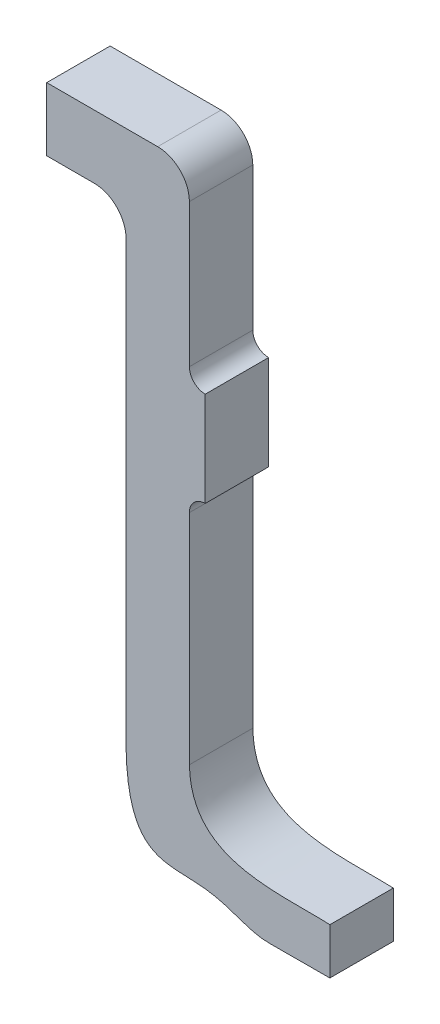
from build123d import *

# Parameters (mm, degrees)
BOSS_EXTRUDE1_DEPTH = 0.2
SKETCH2_W           = 0.2
SKETCH2_H           = 0.298604146
BOSS_EXTRUDE2_DEPTH = 0.05
FILLET1_R           = 0.05


with BuildPart() as part:
    # Sketch1 → Boss-Extrude1 (new body)
    with BuildSketch(Plane.XY):
        with BuildLine():
            Line((0.2, 0.699374902), (0.2, 0.3139984))
            add(Edge.make_bspline(
                [(0.2, 0.3139984), (0.205117782, 0.01722479), (0.336091093, 0.065107428), (0.524474595, 0.036055776), (0.597315342, -0.000257939), (0.727358441, -0.001083087), (0.736855282, 0.000318751), (0.843149125, 0)],
                knots=[0, 0, 0, 0, 0.386744718, 0.431584631, 0.602654437, 0.661634346, 1, 1, 1, 1], degree=3))
            Line((0.843149125, 0), (0.843149125, 0.145674502))
            add(Edge.make_bspline(
                [(0.4, 0.3609291), (0.405330144, 0.110576826), (0.678357666, 0.153432989), (0.843149125, 0.145674502)],
                knots=[0, 0, 0, 0, 1, 1, 1, 1], degree=3))
            Line((0.4, 0.3609291), (0.4, 0.948501248))
            Line((0.4, 0.948501248), (0.4, 1.899374902))
            ThreePointArc((0.4, 1.899374902), (0.370710678, 1.97008558), (0.3, 1.999374902))
            Line((0.3, 1.999374902), (-0.05, 1.999374902))
            Line((-0.05, 1.999374902), (-0.05, 1.799374902))
            Line((-0.05, 1.799374902), (0.1, 1.799374902))
            ThreePointArc((0.1, 1.799374902), (0.170710678, 1.77008558), (0.2, 1.699374902))
            Line((0.2, 1.699374902), (0.2, 0.699374902))
        make_face()
    extrude(amount=BOSS_EXTRUDE1_DEPTH)

    # Sketch2 → Boss-Extrude2 (add)
    with BuildSketch(Plane(origin=(0.4, 0, 0), x_dir=(0, 0, -1), z_dir=(1, 0, 0))):
        with Locations((-0.1, 1.249020091)):
            Rectangle(SKETCH2_W, SKETCH2_H)
    extrude(amount=BOSS_EXTRUDE2_DEPTH)

    # Fillet1
    fillet1_edges = [part.edges().sort_by_distance(p)[0] for p in [
        (0.4, 1.099718018, 0.1),
        (0.4, 1.398322164, 0.1),
    ]]
    fillet(fillet1_edges, radius=FILLET1_R - 0.0001)  # a hair under: the kernel refuses the full size


solid = part.part
